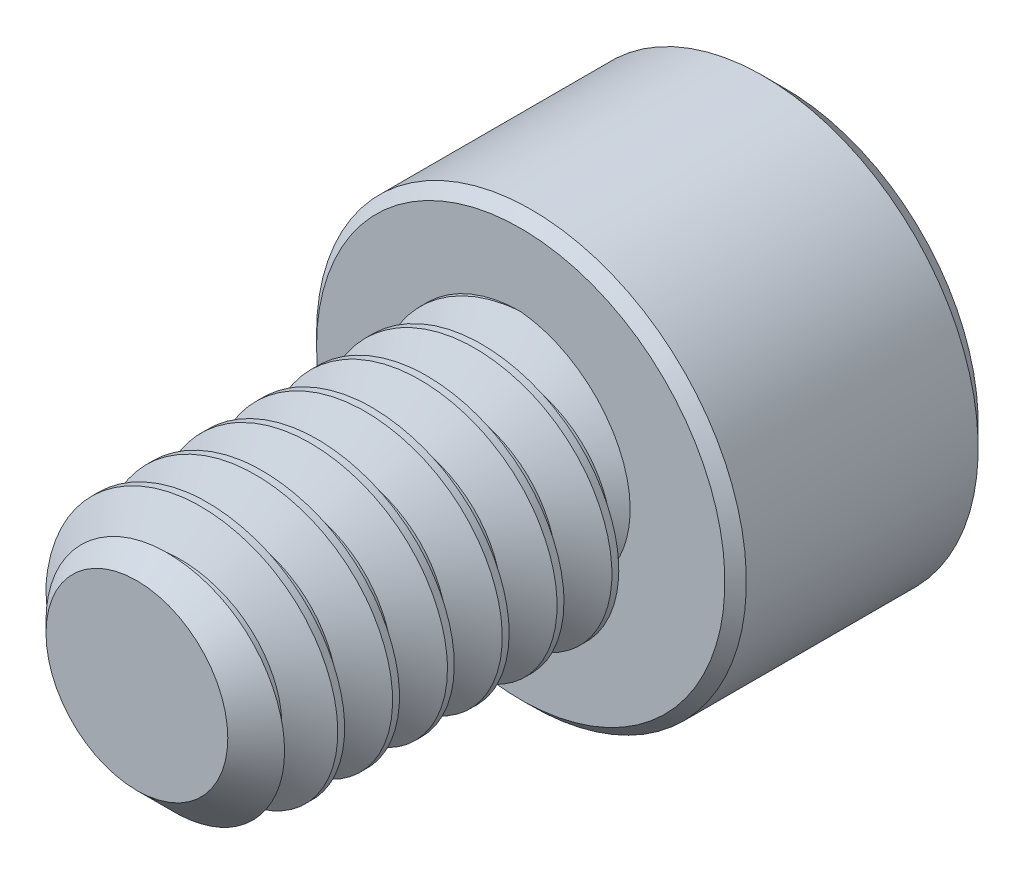
from build123d import *

# Parameters (mm, degrees)
SKETCH1_R          = 1.0922
EXTRUDE1_DEPTH     = 3.175
CHAMFER3_SIZE      = 0.340178571
CUT_SWEEP1_PITCH   = 0.453571429
SKETCH6_R          = 1.778
EXTRUDE2_DEPTH     = 2.1844
CUT_EXTRUDE1_DEPTH = 1.48828125
CHAMFER1_SIZE      = 0.1778
CHAMFER2_SIZE      = 0.0889


with BuildPart() as part:
    # Sketch1 → Extrude1 (new body)
    with BuildSketch(Plane.XY):
        Circle(SKETCH1_R)
    extrude(amount=-EXTRUDE1_DEPTH)

    # Chamfer3
    chamfer3_edges = [part.edges().sort_by_distance(p)[0] for p in [
        (-1.0922, 0, 0),
    ]]
    chamfer(chamfer3_edges, length=CHAMFER3_SIZE)

    # Cut-Sweep1: the profile of Sketch3 profile screwed along a right-hand helix of 8 turns, 6 arcs to a turn; built about Z, then put on its axis
    cut_sweep1_z = Axis((0, 0, 0), (0, 0, 1))
    cut_sweep1_corners = [(1.0925, 0, -0.397048205), (0.797596715, 0, -0.226785714), (0.797596715, 0, -0.170089286), (1.0925, 0, 0.000173205)]
    with BuildLine(mode=Mode.PRIVATE) as cut_sweep1_profile:
        Line(cut_sweep1_corners[0], cut_sweep1_corners[1])
        Line(cut_sweep1_corners[1], cut_sweep1_corners[2])
        Line(cut_sweep1_corners[2], cut_sweep1_corners[3])
        Line(cut_sweep1_corners[3], cut_sweep1_corners[0])
    cut_sweep1_cap = Face(cut_sweep1_profile.wire())
    cut_sweep1_turn_angles = [0, 30, 60, 90, 120, 150, 180, 210, 240, 270, 300, 330, 360]
    cut_sweep1_turn_weights = [1, 0.8660254037844387, 1, 0.8660254037844387, 1, 0.8660254037844387, 1, 0.8660254037844387, 1, 0.8660254037844387, 1, 0.8660254037844387, 1]
    cut_sweep1_turn_rails = [Edge.make_bspline([Vector(p[0], p[1], 0).rotate(cut_sweep1_z, cut_sweep1_turn_angles[k]) / cut_sweep1_turn_weights[k] + Vector(0, 0, p[2] + CUT_SWEEP1_PITCH * cut_sweep1_turn_angles[k] / 360) for k in range(13)], [0, 0, 0, 1, 1, 2, 2, 3, 3, 4, 4, 5, 5, 6, 6, 6], 2, cut_sweep1_turn_weights) for p in cut_sweep1_corners]
    cut_sweep1_turn_sides = [Face.make_surface_from_curves(cut_sweep1_turn_rails[p[0]], cut_sweep1_turn_rails[p[1]]) for p in [(0, 1), (1, 2), (2, 3), (3, 0)]]
    cut_sweep1 = Plane(origin=(0, 0, 0), x_dir=(0, 1, 0), z_dir=(0, 0, -1)) * Solid(Shell([*[p.moved(Location((0, 0, CUT_SWEEP1_PITCH * i))) for i in range(8) for p in cut_sweep1_turn_sides], cut_sweep1_cap, cut_sweep1_cap.rotate(cut_sweep1_z, 2880).moved(Location((0, 0, CUT_SWEEP1_PITCH * 2880 / 360)))]))
    add(cut_sweep1, mode=Mode.SUBTRACT)

    # Sketch6 → Extrude2 (add)
    with BuildSketch(Plane(origin=(0, 0, -3.175), x_dir=(-1, 0, 0), z_dir=(0, 0, -1))):
        Circle(SKETCH6_R)
    extrude(amount=EXTRUDE2_DEPTH)

    # Sketch7 → Cut-Extrude1 (cut)
    with BuildSketch(Plane(origin=(0, 0, -5.3594), x_dir=(-1, 0, 0), z_dir=(0, 0, -1))):
        Polygon((0, 1.14567944), (-0.9921875, 0.57283972), (-0.9921875, -0.57283972), (0, -1.14567944), (0.9921875, -0.57283972), (0.9921875, 0.57283972), align=None)
    extrude(amount=-CUT_EXTRUDE1_DEPTH, mode=Mode.SUBTRACT)

    # Cut-Extrude2 cone 1 section (through the dimple's axis) → Cut-Extrude2 (revolve, cut)
    with BuildSketch(Plane(origin=(0, 0, -5.3594), x_dir=(0, 1, 0), z_dir=(1, 0, 0))):
        Polygon((0, 0), (1.14567944, 0), (0, 1.14567944), align=None)
    revolve(axis=Axis((0, 0, -5.3594), (0, 0, 1)), mode=Mode.SUBTRACT)

    # Chamfer1
    chamfer1_edges = [part.edges().sort_by_distance(p)[0] for p in [
        (1.778, 0, -5.3594),
    ]]
    chamfer(chamfer1_edges, length=CHAMFER1_SIZE)

    # Chamfer2
    chamfer2_edges = [part.edges().sort_by_distance(p)[0] for p in [
        (1.778, 0, -3.175),
    ]]
    chamfer(chamfer2_edges, length=CHAMFER2_SIZE)


solid = part.part
